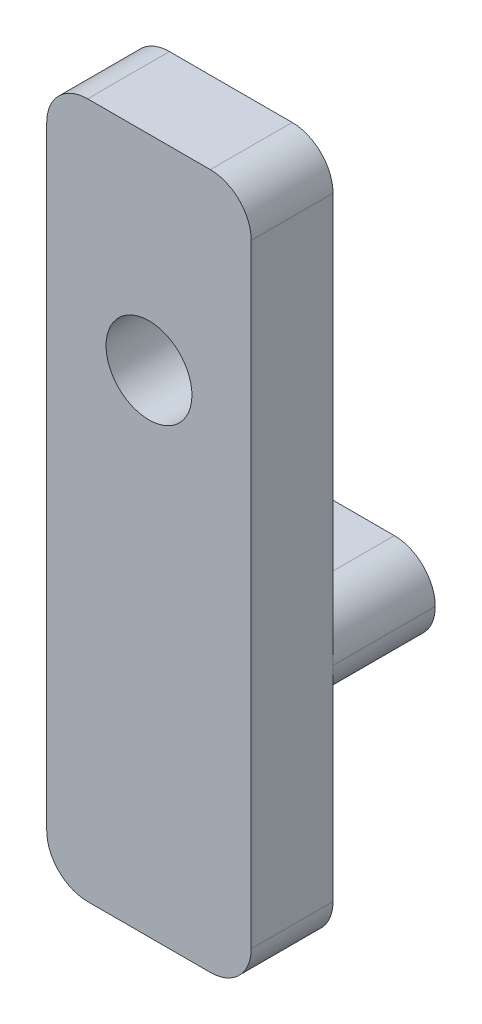
from build123d import *

# Parameters (mm, degrees)
EXTRUDE_1_DEPTH     = 5
FILLET_1_R          = 2
SKETCH_2_R          = 2.1
CUT_EXTRUDE_1_DEPTH = 26.019992006


with BuildPart() as part:
    # Эскиз1 → Бобышка-Вытянуть1 (new, symmetric)
    with BuildSketch(Plane(origin=(0, 0, 0), x_dir=(0, 0, -1), z_dir=(1, 0, 0))):
        Polygon((0, 0), (0, 24), (4, 24), (4, 4), (9, 4), (9, 0), (4, 0), (4, -10), (0, -10), align=None)
    extrude(amount=EXTRUDE_1_DEPTH, both=True)

    # Скругление1
    fillet_1_edges = [part.edges().sort_by_distance(p)[0] for p in [
        (-5, 0, -6.5),
        (-5, 4, -6.5),
        (5, 4, -6.5),
        (5, 0, -6.5),
        (5, 24, -2),
        (-5, 24, -2),
        (-5, -10, -2),
        (5, -10, -2),
    ]]
    fillet(fillet_1_edges, radius=FILLET_1_R - 0.0001)  # a hair under: the kernel refuses the full size

    # Эскиз2 → Вырез-Вытянуть1 (cut, through all)
    with BuildSketch(Plane(origin=(0, 0, -4), x_dir=(-1, 0, 0), z_dir=(0, 0, -1))):
        with Locations(Location((0, 14, 0), (0, 0, 90))):
            Circle(SKETCH_2_R)
    extrude(amount=-CUT_EXTRUDE_1_DEPTH, mode=Mode.SUBTRACT)


solid = part.part
